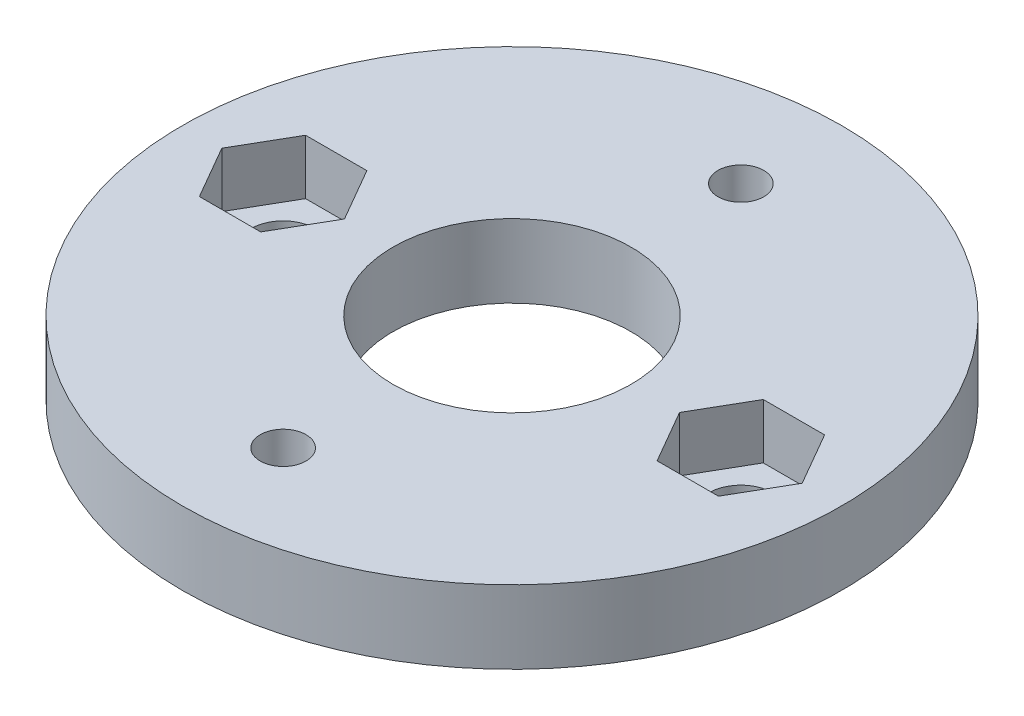
from build123d import *

# Parameters (mm, degrees)
SKETCH_1_R               = 18
SKETCH_1_R_2             = 6.5
EXTRUDE_356_DEPTH        = 4
CUT_EXTRUDE_522_DEPTH    = 3
SKETCH_3_R               = 1.75
CUT_EXTRUDE_703_DEPTH    = 26.632011236
SKETCH_4_R               = 1.25
CUT_EXTRUDE_911_DEPTH    = 26.768197453
PATTERN_CIRCULAR_1_COUNT = 2


with BuildPart() as part:
    # Эскиз1 → Extrude 356 (new body)
    with BuildSketch(Plane(origin=(0, 0, 0), x_dir=(1, 0, 0), z_dir=(0, 1, 0))):
        Circle(SKETCH_1_R)
        Circle(SKETCH_1_R_2, mode=Mode.SUBTRACT)
    extrude(amount=EXTRUDE_356_DEPTH)

    # Эскиз2 → Cut-Extrude 522 (cut)
    with BuildSketch(Plane(origin=(0, 4, 0), x_dir=(1, 0, 0), z_dir=(0, 1, 0))):
        Polygon((15.848631561, 0), (14.174315781, 2.9), (10.825684219, 2.9), (9.151368439, 0), (10.825684219, -2.9), (14.174315781, -2.9), align=None)
    cut_extrude_522 = extrude(amount=-CUT_EXTRUDE_522_DEPTH, mode=Mode.SUBTRACT)

    # Эскиз3 → Cut-Extrude 703 (cut, through all)
    with BuildSketch(Plane(origin=(0, 1, 0), x_dir=(1, 0, 0), z_dir=(0, 1, 0))):
        with Locations((12.5, 0)):
            Circle(SKETCH_3_R)
    cut_extrude_703 = extrude(amount=-CUT_EXTRUDE_703_DEPTH, mode=Mode.SUBTRACT)

    # Эскиз4 → Cut-Extrude 911 (cut, through all)
    with BuildSketch(Plane(origin=(0, 4, 0), x_dir=(1, 0, 0), z_dir=(0, 1, 0))):
        with Locations((0, 12.5)):
            Circle(SKETCH_4_R)
    cut_extrude_911 = extrude(amount=-CUT_EXTRUDE_911_DEPTH, mode=Mode.SUBTRACT)

    # Круговой массив1: Cut-Extrude 522, Cut-Extrude 703, Cut-Extrude 911 ×2 about axis
    pattern_circular_1_axis = Axis((0, 4, 0), (0, -1, 0))
    add([cut_extrude_522.rotate(pattern_circular_1_axis, i * 360 / PATTERN_CIRCULAR_1_COUNT) for i in range(1, PATTERN_CIRCULAR_1_COUNT)], mode=Mode.SUBTRACT)
    add([cut_extrude_703.rotate(pattern_circular_1_axis, i * 360 / PATTERN_CIRCULAR_1_COUNT) for i in range(1, PATTERN_CIRCULAR_1_COUNT)], mode=Mode.SUBTRACT)
    add([cut_extrude_911.rotate(pattern_circular_1_axis, i * 360 / PATTERN_CIRCULAR_1_COUNT) for i in range(1, PATTERN_CIRCULAR_1_COUNT)], mode=Mode.SUBTRACT)


solid = part.part
